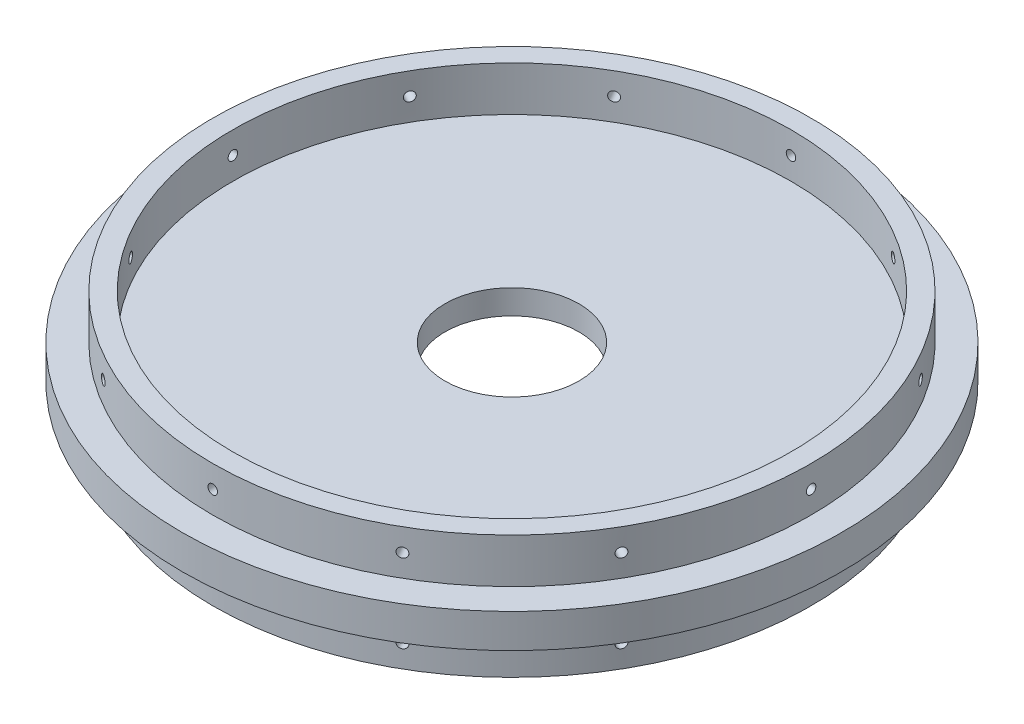
from build123d import *

# Parameters (mm, degrees)
SKETCH1_R                = 93.726
BOSS_EXTRUDE1_DEPTH      = 4.826
SKETCH4_R                = 85.09
SKETCH4_R_2              = 79.375
BOSS_EXTRUDE2_DEPTH      = 12.7
SKETCH5_R                = 1.35255
CUT_EXTRUDE2_DEPTH       = 12.7
CIRPATTERN1_COUNT        = 12
MIRROR2_COPY_1_SKETCH_R  = 1.35255
MIRROR2_COPY_1_DEPTH     = 12.7
MIRROR2_COPY_2_SKETCH_R  = 1.35255
MIRROR2_COPY_2_DEPTH     = 12.7
MIRROR2_COPY_3_SKETCH_R  = 1.35255
MIRROR2_COPY_3_DEPTH     = 12.7
MIRROR2_COPY_4_SKETCH_R  = 1.35255
MIRROR2_COPY_4_DEPTH     = 12.7
MIRROR2_COPY_5_SKETCH_R  = 1.35255
MIRROR2_COPY_5_DEPTH     = 12.7
MIRROR2_COPY_6_SKETCH_R  = 1.35255
MIRROR2_COPY_6_DEPTH     = 12.7
MIRROR2_COPY_7_SKETCH_R  = 1.35255
MIRROR2_COPY_7_DEPTH     = 12.7
MIRROR2_COPY_8_SKETCH_R  = 1.35255
MIRROR2_COPY_8_DEPTH     = 12.7
MIRROR2_COPY_9_SKETCH_R  = 1.35255
MIRROR2_COPY_9_DEPTH     = 12.7
MIRROR2_COPY_10_SKETCH_R = 1.35255
MIRROR2_COPY_10_DEPTH    = 12.7
MIRROR2_COPY_11_SKETCH_R = 1.35255
MIRROR2_COPY_11_DEPTH    = 12.7
SKETCH7_R                = 19.05
CUT_EXTRUDE4_DEPTH       = 135.420006176


with BuildPart() as part:
    # Sketch1 → Boss-Extrude1 (new, symmetric)
    with BuildSketch(Plane(origin=(0, 0, 0), x_dir=(1, 0, 0), z_dir=(0, 1, 0))):
        Circle(SKETCH1_R)
    extrude(amount=BOSS_EXTRUDE1_DEPTH, both=True)

    # Sketch2 → Cut-Revolve1 (revolve, cut)
    with BuildSketch(Plane.XY):
        with BuildLine():
            Line((0, -4.826), (-25.4, -4.826))
            add(Edge.make_bspline(
                [(0, 1.27), (-5.119708802, 1.512901127), (-13.685198777, -0.496611023), (-22.158477128, -2.939757283), (-25.4, -4.826)],
                knots=[0, 0, 0, 0, 0.575798634, 1, 1, 1, 1], degree=3))
            Line((0, 1.27), (0, -4.826))
        make_face()
    revolve(axis=Axis((0, -18.327530441, 0), (0, 1, 0)), mode=Mode.SUBTRACT)

    # Sketch4 → Boss-Extrude2 (add)
    with BuildSketch(Plane(origin=(0, 4.826, 0), x_dir=(1, 0, 0), z_dir=(0, 1, 0))):
        Circle(SKETCH4_R)
        Circle(SKETCH4_R_2, mode=Mode.SUBTRACT)
    boss_extrude2 = extrude(amount=BOSS_EXTRUDE2_DEPTH)

    # Sketch5 → Cut-Extrude2 (cut)
    with BuildSketch(Plane(origin=(0, 0, -85.09), x_dir=(-1, 0, 0), z_dir=(0, 0, -1))):
        with Locations((0, 11.176)):
            Circle(SKETCH5_R)
    cut_extrude2 = extrude(amount=-CUT_EXTRUDE2_DEPTH, mode=Mode.SUBTRACT)

    # CirPattern1: Cut-Extrude2 ×12 about axis
    cirpattern1_axis = Axis((0, 17.526, 0), (0, -1, 0))
    for i in range(1, CIRPATTERN1_COUNT):
        add(cut_extrude2.rotate(cirpattern1_axis, i * 360 / CIRPATTERN1_COUNT), mode=Mode.SUBTRACT)

    # Mirror2: Boss-Extrude2, Cut-Extrude2 across plane
    add(boss_extrude2.mirror(Plane.ZX))
    add(cut_extrude2.mirror(Plane.ZX), mode=Mode.SUBTRACT)

    # Mirror2 copy 1 sketch → Mirror2 copy 1 (cut)
    with BuildSketch(Plane(origin=(42.545, 0, -73.690101608), x_dir=(-0.8660254037844387, 0, -0.49999999999999994), z_dir=(0.49999999999999994, 0, -0.8660254037844387))):
        with Locations((0, -11.176)):
            Circle(MIRROR2_COPY_1_SKETCH_R)
    extrude(amount=-MIRROR2_COPY_1_DEPTH, mode=Mode.SUBTRACT)

    # Mirror2 copy 2 sketch → Mirror2 copy 2 (cut)
    with BuildSketch(Plane(origin=(73.690101608, 0, -42.545), x_dir=(-0.5000000000000001, 0, -0.8660254037844386), z_dir=(0.8660254037844386, 0, -0.5000000000000001))):
        with Locations((0, -11.176)):
            Circle(MIRROR2_COPY_2_SKETCH_R)
    extrude(amount=-MIRROR2_COPY_2_DEPTH, mode=Mode.SUBTRACT)

    # Mirror2 copy 3 sketch → Mirror2 copy 3 (cut)
    with BuildSketch(Plane(origin=(85.09, 0, 0), x_dir=(0, 0, -1), z_dir=(1, 0, 0))):
        with Locations((0, -11.176)):
            Circle(MIRROR2_COPY_3_SKETCH_R)
    extrude(amount=-MIRROR2_COPY_3_DEPTH, mode=Mode.SUBTRACT)

    # Mirror2 copy 4 sketch → Mirror2 copy 4 (cut)
    with BuildSketch(Plane(origin=(73.690101608, 0, 42.545), x_dir=(0.4999999999999998, 0, -0.8660254037844387), z_dir=(0.8660254037844387, 0, 0.4999999999999998))):
        with Locations((0, -11.176)):
            Circle(MIRROR2_COPY_4_SKETCH_R)
    extrude(amount=-MIRROR2_COPY_4_DEPTH, mode=Mode.SUBTRACT)

    # Mirror2 copy 5 sketch → Mirror2 copy 5 (cut)
    with BuildSketch(Plane(origin=(42.545, 0, 73.690101608), x_dir=(0.8660254037844387, 0, -0.49999999999999994), z_dir=(0.49999999999999994, 0, 0.8660254037844387))):
        with Locations((0, -11.176)):
            Circle(MIRROR2_COPY_5_SKETCH_R)
    extrude(amount=-MIRROR2_COPY_5_DEPTH, mode=Mode.SUBTRACT)

    # Mirror2 copy 6 sketch → Mirror2 copy 6 (cut)
    with BuildSketch(Plane.XY.offset(85.09)):
        with Locations((0, -11.176)):
            Circle(MIRROR2_COPY_6_SKETCH_R)
    extrude(amount=-MIRROR2_COPY_6_DEPTH, mode=Mode.SUBTRACT)

    # Mirror2 copy 7 sketch → Mirror2 copy 7 (cut)
    with BuildSketch(Plane(origin=(-42.545, 0, 73.690101608), x_dir=(0.8660254037844386, 0, 0.5000000000000001), z_dir=(-0.5000000000000001, 0, 0.8660254037844386))):
        with Locations((0, -11.176)):
            Circle(MIRROR2_COPY_7_SKETCH_R)
    extrude(amount=-MIRROR2_COPY_7_DEPTH, mode=Mode.SUBTRACT)

    # Mirror2 copy 8 sketch → Mirror2 copy 8 (cut)
    with BuildSketch(Plane(origin=(-73.690101608, 0, 42.545), x_dir=(0.5000000000000004, 0, 0.8660254037844384), z_dir=(-0.8660254037844384, 0, 0.5000000000000004))):
        with Locations((0, -11.176)):
            Circle(MIRROR2_COPY_8_SKETCH_R)
    extrude(amount=-MIRROR2_COPY_8_DEPTH, mode=Mode.SUBTRACT)

    # Mirror2 copy 9 sketch → Mirror2 copy 9 (cut)
    with BuildSketch(Plane.ZY.offset(85.09)):
        with Locations((0, -11.176)):
            Circle(MIRROR2_COPY_9_SKETCH_R)
    extrude(amount=-MIRROR2_COPY_9_DEPTH, mode=Mode.SUBTRACT)

    # Mirror2 copy 10 sketch → Mirror2 copy 10 (cut)
    with BuildSketch(Plane(origin=(-73.690101608, 0, -42.545), x_dir=(-0.5000000000000001, 0, 0.8660254037844386), z_dir=(-0.8660254037844386, 0, -0.5000000000000001))):
        with Locations((0, -11.176)):
            Circle(MIRROR2_COPY_10_SKETCH_R)
    extrude(amount=-MIRROR2_COPY_10_DEPTH, mode=Mode.SUBTRACT)

    # Mirror2 copy 11 sketch → Mirror2 copy 11 (cut)
    with BuildSketch(Plane(origin=(-42.545, 0, -73.690101608), x_dir=(-0.8660254037844384, 0, 0.5000000000000004), z_dir=(-0.5000000000000004, 0, -0.8660254037844384))):
        with Locations((0, -11.176)):
            Circle(MIRROR2_COPY_11_SKETCH_R)
    extrude(amount=-MIRROR2_COPY_11_DEPTH, mode=Mode.SUBTRACT)

    # Sketch7 → Cut-Extrude4 (cut, through all)
    with BuildSketch(Plane.XZ.offset(4.826)):
        Circle(SKETCH7_R)
    extrude(amount=-CUT_EXTRUDE4_DEPTH, mode=Mode.SUBTRACT)


solid = part.part
